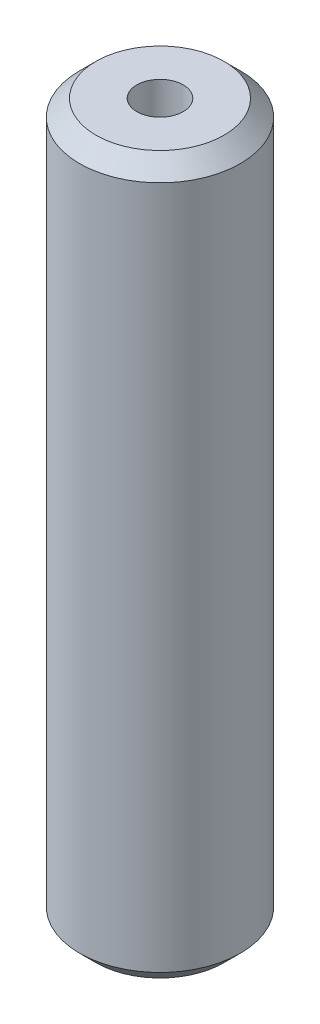
from build123d import *

# Parameters (mm, degrees)
SKETCH1_R           = 5
BOSS_EXTRUDE1_DEPTH = 44.557233752
SKETCH2_R           = 1.443500048
CUT_EXTRUDE1_DEPTH  = 46.114821064
CHAMFER1_SIZE       = 1.019051518


with BuildPart() as part:
    # Sketch1 → Boss-Extrude1 (new body)
    with BuildSketch(Plane(origin=(0, 0, 0), x_dir=(1, 0, 0), z_dir=(0, 1, 0))):
        Circle(SKETCH1_R)
    extrude(amount=BOSS_EXTRUDE1_DEPTH)

    # Sketch2 → Cut-Extrude1 (cut, through all)
    with BuildSketch(Plane(origin=(0, 0, 0), x_dir=(1, 0, 0), z_dir=(0, 1, 0))):
        Circle(SKETCH2_R)
    extrude(amount=CUT_EXTRUDE1_DEPTH, mode=Mode.SUBTRACT)

    # Chamfer1
    chamfer1_edges = [part.edges().sort_by_distance(p)[0] for p in [
        (-5, 44.557233752, 0),
        (-5, 0, 0),
    ]]
    chamfer(chamfer1_edges, length=CHAMFER1_SIZE)


solid = part.part
